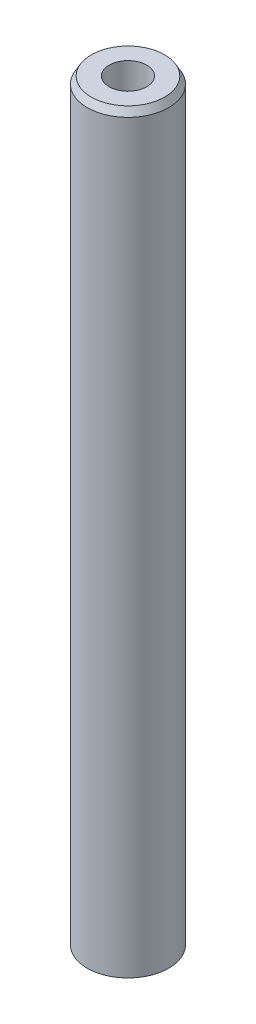
from build123d import *
from OCP.BRepFilletAPI import BRepFilletAPI_MakeChamfer

# Parameters (mm, degrees)
SKETCH1_R           = 7.5
BOSS_EXTRUDE1_DEPTH = 139.242795295
SKETCH2_R           = 3.45885792
CUT_EXTRUDE1_DEPTH  = 140.646181622
CHAMFER1_SIZE       = 1.301126265
CHAMFER1_SIZE2      = 0.751205599


with BuildPart() as part:
    # Sketch1 → Boss-Extrude1 (new body)
    with BuildSketch(Plane(origin=(0, 0, 0), x_dir=(1, 0, 0), z_dir=(0, 1, 0))):
        Circle(SKETCH1_R)
    extrude(amount=BOSS_EXTRUDE1_DEPTH)

    # Sketch2 → Cut-Extrude1 (cut, through all)
    with BuildSketch(Plane(origin=(0, 0, 0), x_dir=(1, 0, 0), z_dir=(0, 1, 0))):
        Circle(SKETCH2_R)
    extrude(amount=CUT_EXTRUDE1_DEPTH, mode=Mode.SUBTRACT)

    # Chamfer1: one chamfer whose edges measure the first distance from different faces: ONE call of the kernel's chamfer builder (chamfer() names one face for all edges)
    chamfer1_edges_1 = [part.edges().sort_by_distance(p)[0] for p in [
        (-7.5, 139.242795295, 0),
    ]]
    chamfer1_side_1 = [part.faces().sort_by_distance(p)[0] for p in [
        (-7.5, 69.621397648, 0),
    ]]
    chamfer1_edges_2 = [part.edges().sort_by_distance(p)[0] for p in [
        (-7.5, 0, 0),
    ]]
    chamfer1_side_2 = [part.faces().sort_by_distance(p)[0] for p in [
        (-7.287867966, 0, 0),
    ]]
    chamfer1 = BRepFilletAPI_MakeChamfer(part.part.solid().wrapped)
    for e in chamfer1_edges_1:
        chamfer1.Add(CHAMFER1_SIZE, CHAMFER1_SIZE2, e.wrapped, chamfer1_side_1[0].wrapped)  # the first distance lies on this face
    for e in chamfer1_edges_2:
        chamfer1.Add(CHAMFER1_SIZE, CHAMFER1_SIZE2, e.wrapped, chamfer1_side_2[0].wrapped)  # the first distance lies on this face
    add(Compound.cast(chamfer1.Shape()), mode=Mode.REPLACE)


solid = part.part
